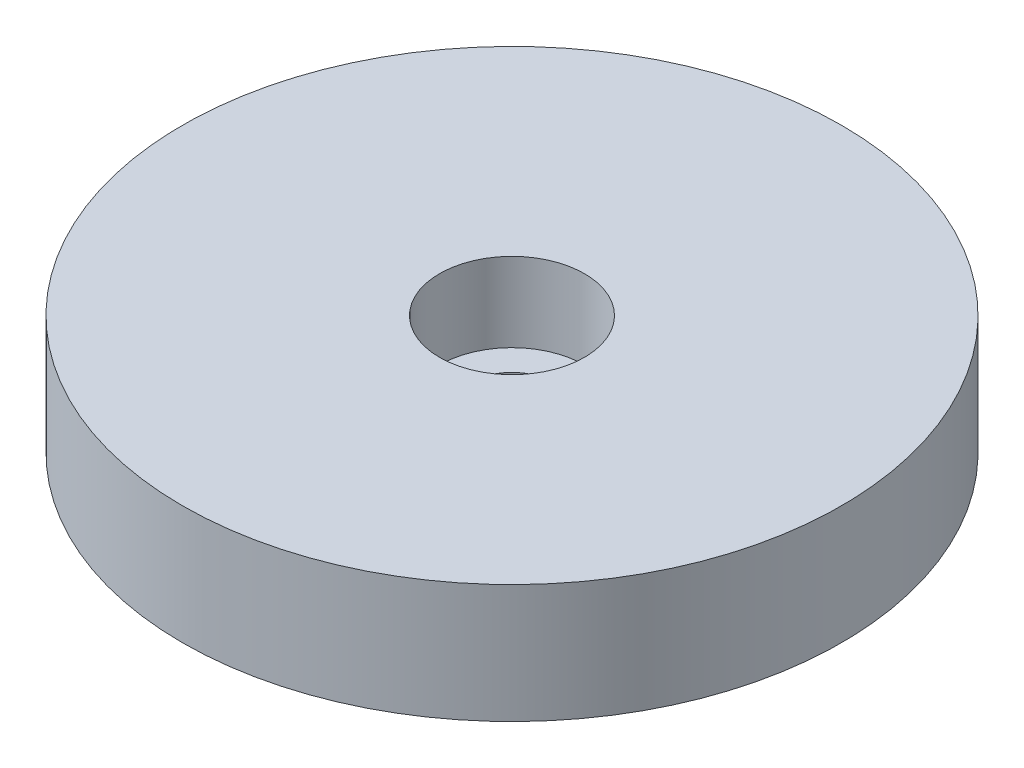
from build123d import *

# Parameters (mm, degrees)
CROQUIS1_R              = 25
CROQUIS1_R_2            = 3.2
SALIENTE_EXTRUIR1_DEPTH = 9
CROQUIS3_R              = 5.5
CORTAR_EXTRUIR1_DEPTH   = 6


with BuildPart() as part:
    # Croquis1 → Saliente-Extruir1 (new body)
    with BuildSketch(Plane(origin=(0, 0, 0), x_dir=(1, 0, 0), z_dir=(0, 1, 0))):
        Circle(CROQUIS1_R)
        Circle(CROQUIS1_R_2, mode=Mode.SUBTRACT)
    extrude(amount=SALIENTE_EXTRUIR1_DEPTH)

    # Croquis3 → Cortar-Extruir1 (cut)
    with BuildSketch(Plane(origin=(0, 9, 0), x_dir=(1, 0, 0), z_dir=(0, 1, 0))):
        Circle(CROQUIS3_R)
    extrude(amount=-CORTAR_EXTRUIR1_DEPTH, mode=Mode.SUBTRACT)


solid = part.part
